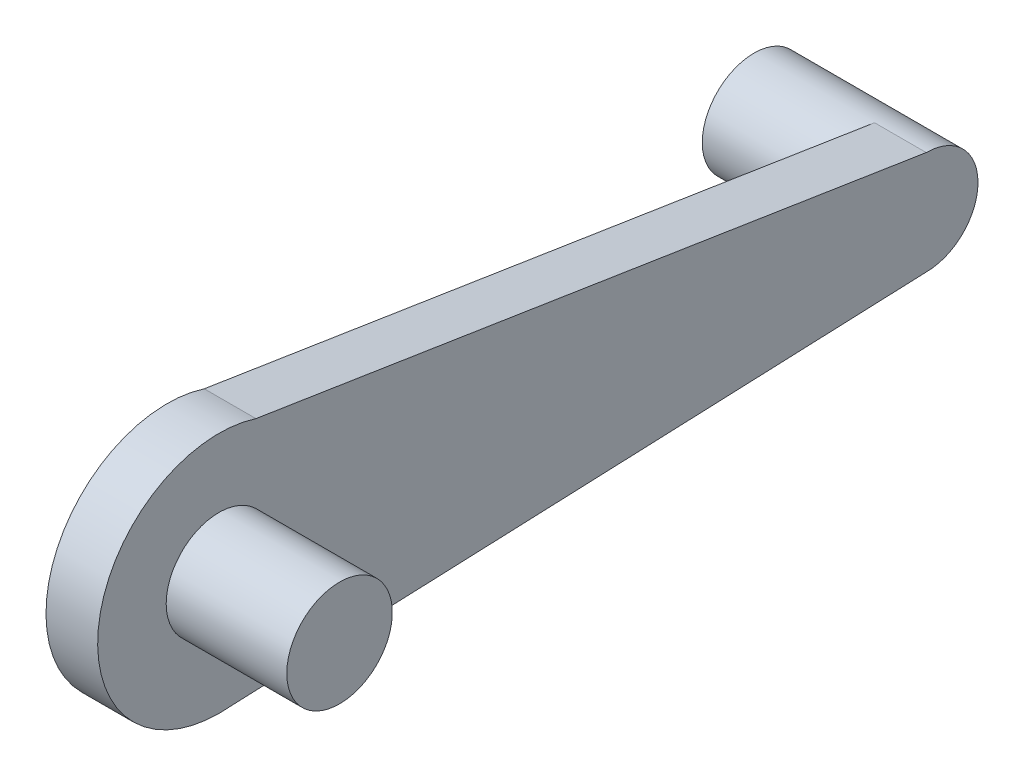
from build123d import *

# Parameters (mm, degrees)
SKETCH2_R           = 3.063635792
BOSS_EXTRUDE3_DEPTH = 7
SKETCH4_R           = 7.041546439
BOSS_EXTRUDE5_DEPTH = 3
SKETCH9_R           = 3.003465055
BOSS_EXTRUDE7_DEPTH = 3
BOSS_EXTRUDE8_DEPTH = 3
SKETCH11_R          = 3.003465055
BOSS_EXTRUDE9_DEPTH = 7
SCALE1_SCALE        = 3.8632269


with BuildPart() as part:
    # Sketch2 → Boss-Extrude3 (new body)
    with BuildSketch(Plane.ZY):
        with Locations((-10.440955589, 10.776713286)):
            Circle(SKETCH2_R)
    extrude(amount=BOSS_EXTRUDE3_DEPTH)

    # Sketch4 → Boss-Extrude5 (add)
    with BuildSketch(Plane.ZY.offset(7)):
        with Locations((-10.440955589, 10.776713286)):
            Circle(SKETCH4_R)
    extrude(amount=BOSS_EXTRUDE5_DEPTH)

    # Sketch10 → Boss-Extrude8 (add)
    with BuildSketch(Plane.ZY.offset(10)):
        Polygon((-10.440955589, 17.818259726), (-51.501250636, 11.402954855), (-51.501250636, 5.396024744), (-10.440955589, 3.735166847), align=None)
    extrude(amount=-BOSS_EXTRUDE8_DEPTH)



with BuildPart() as body_2:
    # Sketch9 → Boss-Extrude7 (new body)
    with BuildSketch(Plane.ZY.offset(7)):
        with Locations((-51.501250636, 8.3994898)):
            Circle(SKETCH9_R)
    extrude(amount=BOSS_EXTRUDE7_DEPTH)


with BuildPart() as part_1:
    add(part.part)

    add(body_2.part)  # Boss-Extrude9 merges body 2
    # Sketch11 → Boss-Extrude9 (add)
    with BuildSketch(Plane.ZY.offset(10)):
        with Locations((-51.501250636, 8.3994898)):
            Circle(SKETCH11_R)
    extrude(amount=BOSS_EXTRUDE9_DEPTH)


with BuildPart() as part_2:
    # Scale1: scaled about (-8.479078991, 9.815735158, -26.726269481)
    add(part_1.part.scale(SCALE1_SCALE).moved(Location((24.277527054, -28.104676948, 76.523373715))))


solid = part_2.part
